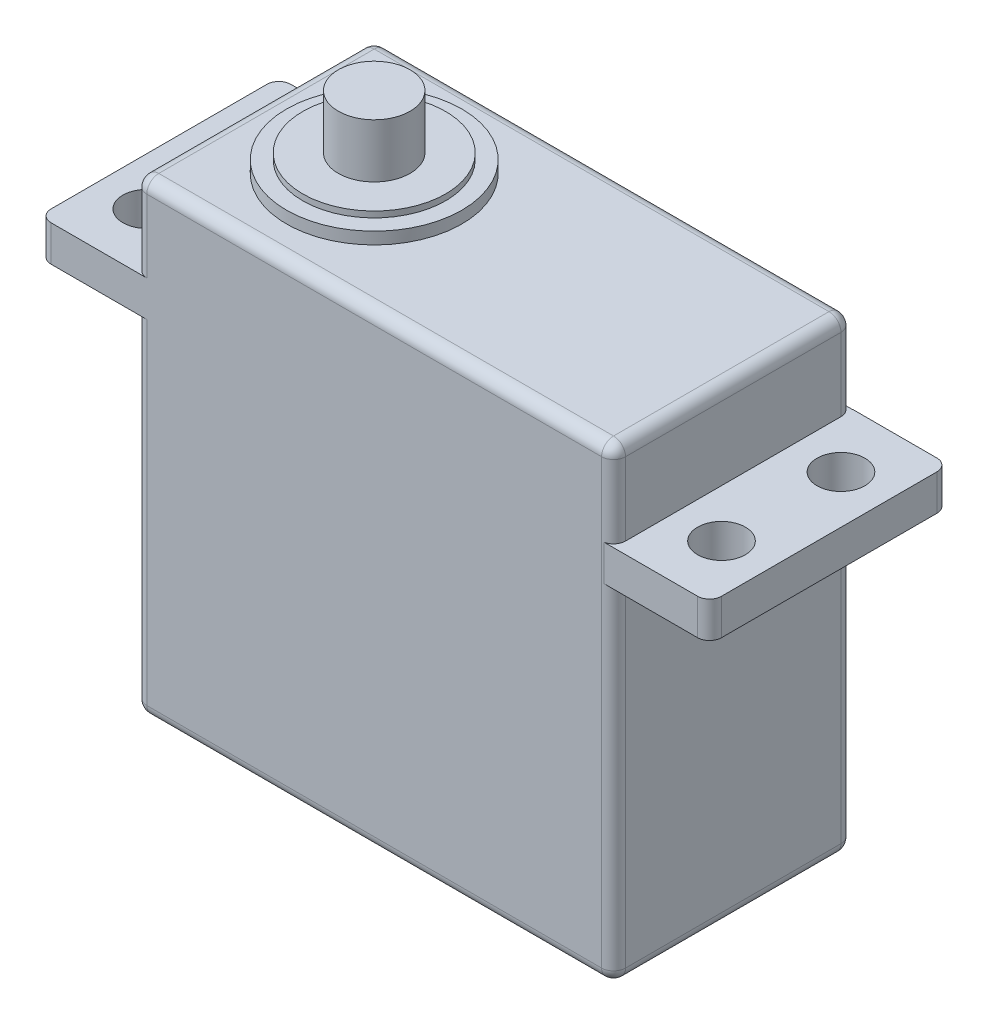
from build123d import *

# Parameters (mm, degrees)
SKETCH_1_W               = 40
SKETCH_1_H               = 39
EXTRUDE_1_DEPTH          = 20
SKETCH_3_W               = 20
SKETCH_3_H               = 3
EXTRUDE_2_DEPTH          = 8
SKETCH_6_W               = 20.033379722
SKETCH_6_H               = 3
EXTRUDE_4_DEPTH          = 8
CUT_EXTRUDE_1_DEPTH      = 38
CUT_EXTRUDE_1_DEPTH_BACK = 50
SKETCH_7_R               = 2
SKETCH_8_R               = 2
CUT_EXTRUDE_2_DEPTH      = 50
SKETCH_9_R               = 3
EXTRUDE_7_DEPTH          = 6
SKETCH_11_R              = 5.970559472
EXTRUDE_8_DEPTH          = 1.5
SKETCH_12_R              = 7.325621725
EXTRUDE_9_DEPTH          = 1
FILLET_3_R               = 1
FILLET_4_R               = 1
FILLET_5_R               = 1
FILLET_8_R               = 1
FILLET_9_R               = 1


with BuildPart() as part:
    # 草图1 → 凸台-拉伸1 (new body)
    with BuildSketch(Plane.XY):
        with Locations((-3.101604278, 17.200534759)):
            Rectangle(SKETCH_1_W, SKETCH_1_H)
    extrude(amount=EXTRUDE_1_DEPTH)

    # 草图3 → 凸台-拉伸2 (add)
    with BuildSketch(Plane(origin=(16.898395722, 0, 0), x_dir=(0, 0, -1), z_dir=(1, 0, 0))):
        with Locations((-9.980536854, 28.09692648)):
            Rectangle(SKETCH_3_W, SKETCH_3_H)
    extrude(amount=EXTRUDE_2_DEPTH)

    # 草图6 → 凸台-拉伸4 (add)
    with BuildSketch(Plane.ZY.offset(23.101604278)):
        with Locations((9.983310139, 28.130306202)):
            Rectangle(SKETCH_6_W, SKETCH_6_H)
    extrude(amount=EXTRUDE_4_DEPTH)

    # 草图7 → 切除-拉伸1 (cut, two sides: drawn at the far end of the back side and taken through both)
    with BuildSketch(Plane(origin=(0, 0, 0), x_dir=(1, 0, 0), z_dir=(0, 1, 0)).offset(-CUT_EXTRUDE_1_DEPTH_BACK)):
        with Locations(Location((-27.101604278, -15, 0), (0, 0, 180))):
            Circle(SKETCH_7_R)
        with Locations(Location((-27.101604278, -4.966620278, 0), (0, 0, 180))):
            Circle(SKETCH_7_R)
    extrude(amount=CUT_EXTRUDE_1_DEPTH + CUT_EXTRUDE_1_DEPTH_BACK, mode=Mode.SUBTRACT)

    # 草图8 → 切除-拉伸2 (cut)
    with BuildSketch(Plane(origin=(0, 29.59692648, 0), x_dir=(1, 0, 0), z_dir=(0, 1, 0))):
        with Locations(Location((20.898395722, -5, 0), (0, 0, 180))):
            Circle(SKETCH_8_R)
        with Locations(Location((20.898395722, -14.980536854, 0), (0, 0, 180))):
            Circle(SKETCH_8_R)
    extrude(amount=-CUT_EXTRUDE_2_DEPTH, mode=Mode.SUBTRACT)

    # 草图9 → 凸台-拉伸7 (add)
    with BuildSketch(Plane(origin=(0, 36.700534759, 0), x_dir=(1, 0, 0), z_dir=(0, 1, 0))):
        with Locations(Location((-13.101604278, -10, 0), (0, 0, 90))):
            Circle(SKETCH_9_R)
    extrude(amount=EXTRUDE_7_DEPTH)

    # 草图11 → 凸台-拉伸8 (add)
    with BuildSketch(Plane(origin=(0, 36.700534759, 0), x_dir=(1, 0, 0), z_dir=(0, 1, 0))):
        with Locations(Location((-13.101604278, -10, 0), (0, 0, 90))):
            Circle(SKETCH_11_R)
    extrude(amount=EXTRUDE_8_DEPTH)

    # 草图12 → 凸台-拉伸9 (add)
    with BuildSketch(Plane(origin=(0, 36.700534759, 0), x_dir=(1, 0, 0), z_dir=(0, 1, 0))):
        with Locations(Location((-13.101604278, -10, 0), (0, 0, 90))):
            Circle(SKETCH_12_R)
    extrude(amount=EXTRUDE_9_DEPTH)

    # 圆角3
    # the kernel refuses this fillet: 1 mm, written as the material it takes off along each edge
    with BuildSketch(Plane(origin=(15.898395722, 35.700534759, 19), x_dir=(0, 0, 1), z_dir=(0, 1, 0))) as fillet_3_piece_1_section:
        Polygon((0, 0), (FILLET_3_R, 0), (FILLET_3_R, FILLET_3_R), (0, FILLET_3_R), align=None)
    fillet_3_piece_1 = extrude(amount=FILLET_3_R, mode=Mode.PRIVATE)
    fillet_3_piece_1 = fillet_3_piece_1 - Plane(origin=(15.898395722, 35.700534759, 19), x_dir=(-0.7071067811865475, 0, -0.7071067811865475), z_dir=(0, 1, 0)) * Sphere(FILLET_3_R, mode=Mode.PRIVATE)
    add(fillet_3_piece_1, mode=Mode.SUBTRACT)
    with BuildSketch(Plane(origin=(16.898395722, 36.700534759, -2.5), x_dir=(-1, 0, 0), z_dir=(0, 0, 1))) as fillet_3_piece_2:
        with BuildLine():
            CenterArc((FILLET_3_R, FILLET_3_R), FILLET_3_R, 180, 90)
            Line((0, FILLET_3_R), (0, 0))
            Line((0, 0), (FILLET_3_R, 0))
        make_face()
    extrude(amount=21.5, mode=Mode.SUBTRACT)
    with BuildSketch(Plane(origin=(16.898395722, 35.700534759, 20), x_dir=(-1, 0, 0), z_dir=(0, -1, 0))) as fillet_3_piece_3_section:
        with BuildLine():
            CenterArc((FILLET_3_R, FILLET_3_R), FILLET_3_R, 180, 90)
            Line((0, FILLET_3_R), (0, 0))
            Line((0, 0), (FILLET_3_R, 0))
        make_face()
    fillet_3_piece_3 = extrude(amount=40.5, mode=Mode.PRIVATE)
    fillet_3_piece_3 = split(fillet_3_piece_3, bisect_by=Plane(origin=(16.437934638, 29.59692648, 20.00107683), z_dir=(0, 1, 0)), keep=Keep.TOP, mode=Mode.PRIVATE)
    fillet_3_piece_3 = split(fillet_3_piece_3, bisect_by=Plane(origin=(16.437934638, 32.648730619, 19.980536854), z_dir=(0, 0, 1)), keep=Keep.TOP, mode=Mode.PRIVATE)
    add(fillet_3_piece_3, mode=Mode.SUBTRACT)
    with BuildSketch(Plane(origin=(16.898395722, 35.700534759, 20), x_dir=(-1, 0, 0), z_dir=(0, -1, 0))) as fillet_3_piece_4_section:
        with BuildLine():
            CenterArc((FILLET_3_R, FILLET_3_R), FILLET_3_R, 180, 90)
            Line((0, FILLET_3_R), (0, 0))
            Line((0, 0), (FILLET_3_R, 0))
        make_face()
    fillet_3_piece_4 = extrude(amount=40.5, mode=Mode.PRIVATE)
    fillet_3_piece_4 = split(fillet_3_piece_4, bisect_by=Plane(origin=(16.712608884, 29.59692648, 19.734140611), z_dir=(0, 1, 0)), keep=Keep.TOP, mode=Mode.PRIVATE)
    fillet_3_piece_4 = split(fillet_3_piece_4, bisect_by=Plane(origin=(16.712608884, 32.648730619, 19.980536854), z_dir=(0, 0, -1)), keep=Keep.TOP, mode=Mode.PRIVATE)
    add(fillet_3_piece_4, mode=Mode.SUBTRACT)
    with BuildSketch(Plane(origin=(16.898395722, 35.700534759, 20), x_dir=(-1, 0, 0), z_dir=(0, -1, 0))) as fillet_3_piece_5_section:
        with BuildLine():
            CenterArc((FILLET_3_R, FILLET_3_R), FILLET_3_R, 180, 90)
            Line((0, FILLET_3_R), (0, 0))
            Line((0, 0), (FILLET_3_R, 0))
        make_face()
    fillet_3_piece_5 = extrude(amount=40.5, mode=Mode.PRIVATE)
    fillet_3_piece_5 = split(fillet_3_piece_5, bisect_by=Plane(origin=(16.437934638, 29.59692648, 20.00107683), z_dir=(0, -1, 0)), keep=Keep.TOP, mode=Mode.PRIVATE)
    fillet_3_piece_5 = split(fillet_3_piece_5, bisect_by=Plane(origin=(16.437934638, 28.09692648, 19.980536854), z_dir=(0, 0, 1)), keep=Keep.TOP, mode=Mode.PRIVATE)
    fillet_3_piece_5 = split(fillet_3_piece_5, bisect_by=Plane(origin=(16.437934638, 26.59692648, 20.00107683), z_dir=(0, 1, 0)), keep=Keep.TOP, mode=Mode.PRIVATE)
    add(fillet_3_piece_5, mode=Mode.SUBTRACT)
    with BuildSketch(Plane(origin=(16.898395722, 35.700534759, 20), x_dir=(-1, 0, 0), z_dir=(0, -1, 0))) as fillet_3_piece_6_section:
        with BuildLine():
            CenterArc((FILLET_3_R, FILLET_3_R), FILLET_3_R, 180, 90)
            Line((0, FILLET_3_R), (0, 0))
            Line((0, 0), (FILLET_3_R, 0))
        make_face()
    fillet_3_piece_6 = extrude(amount=40.5, mode=Mode.PRIVATE)
    fillet_3_piece_6 = split(fillet_3_piece_6, bisect_by=Plane(origin=(16.437934638, 10.898730619, 19.980536854), z_dir=(0, 0, 1)), keep=Keep.TOP, mode=Mode.PRIVATE)
    fillet_3_piece_6 = split(fillet_3_piece_6, bisect_by=Plane(origin=(16.437934638, 26.59692648, 20.00107683), z_dir=(0, -1, 0)), keep=Keep.TOP, mode=Mode.PRIVATE)
    add(fillet_3_piece_6, mode=Mode.SUBTRACT)
    with BuildSketch(Plane(origin=(16.898395722, 35.700534759, 20), x_dir=(-1, 0, 0), z_dir=(0, -1, 0))) as fillet_3_piece_7_section:
        with BuildLine():
            CenterArc((FILLET_3_R, FILLET_3_R), FILLET_3_R, 180, 90)
            Line((0, FILLET_3_R), (0, 0))
            Line((0, 0), (FILLET_3_R, 0))
        make_face()
    fillet_3_piece_7 = extrude(amount=40.5, mode=Mode.PRIVATE)
    fillet_3_piece_7 = split(fillet_3_piece_7, bisect_by=Plane(origin=(16.712608884, 10.898730619, 19.980536854), z_dir=(0, 0, -1)), keep=Keep.TOP, mode=Mode.PRIVATE)
    fillet_3_piece_7 = split(fillet_3_piece_7, bisect_by=Plane(origin=(16.712608884, 26.59692648, 19.734140611), z_dir=(0, -1, 0)), keep=Keep.TOP, mode=Mode.PRIVATE)
    add(fillet_3_piece_7, mode=Mode.SUBTRACT)
    with BuildSketch(Plane(origin=(-25.601604278, 36.700534759, 20), x_dir=(0, 0, -1), z_dir=(1, 0, 0))) as fillet_3_piece_8:
        with BuildLine():
            CenterArc((FILLET_3_R, -FILLET_3_R), FILLET_3_R, 90, 90)
            Line((0, -FILLET_3_R), (0, 0))
            Line((0, 0), (FILLET_3_R, 0))
        make_face()
    extrude(amount=41.5, mode=Mode.SUBTRACT)

    # 圆角4
    fillet_4_edges = [part.edges().sort_by_distance(p)[0] for p in [
        (-23.101604278, 12.16542048, 0),
        (-23.101604278, 12.16542048, 20),
        (-3.101604278, -2.299465241, 0),
        (-23.101604278, -2.299465241, 10),
        (-3.601604278, -2.299465241, 20),
        (16.898395722, -2.299465241, 9.5),
        (16.605502503, -2.299465241, 19.707106781),
    ]]
    fillet(fillet_4_edges, radius=FILLET_4_R)

    # 圆角5
    # the kernel refuses this fillet: 1 mm, written as the material it takes off along each edge
    with BuildSketch(Plane(origin=(15.898395722, -1.299465241, 1), x_dir=(1, 0, 0), z_dir=(0, 0, -1))) as fillet_5_piece_1_section:
        Polygon((0, 0), (FILLET_5_R * 1.02, 0), (FILLET_5_R * 1.02, FILLET_5_R * 1.02), (0, FILLET_5_R * 1.02), align=None)
    fillet_5_piece_1 = extrude(amount=FILLET_5_R * 1.02, mode=Mode.PRIVATE)
    fillet_5_piece_1 = fillet_5_piece_1 - Plane(origin=(15.898395722, -1.299465241, 1), x_dir=(-0.7071067811865476, 0.7071067811865475, 0), z_dir=(0, 0, -1)) * Sphere(FILLET_5_R, mode=Mode.PRIVATE)
    add(fillet_5_piece_1, mode=Mode.SUBTRACT)
    with BuildSketch(Plane(origin=(-22.101604278, 35.700534759, 1), x_dir=(-1, 0, 0), z_dir=(0, 0, -1))) as fillet_5_piece_2_section:
        Polygon((0, 0), (FILLET_5_R * 1.02, 0), (FILLET_5_R * 1.02, FILLET_5_R * 1.02), (0, FILLET_5_R * 1.02), align=None)
    fillet_5_piece_2 = extrude(amount=FILLET_5_R * 1.02, mode=Mode.PRIVATE)
    fillet_5_piece_2 = fillet_5_piece_2 - Plane(origin=(-22.101604278, 35.700534759, 1), x_dir=(0.7071067811865476, -0.7071067811865475, 0), z_dir=(0, 0, -1)) * Sphere(FILLET_5_R, mode=Mode.PRIVATE)
    add(fillet_5_piece_2, mode=Mode.SUBTRACT)
    with BuildSketch(Plane(origin=(16.898395722, 26.59692648, 0), x_dir=(-1, 0, 0), z_dir=(0, -1, 0))) as fillet_5_piece_3:
        with BuildLine():
            CenterArc((FILLET_5_R, -FILLET_5_R), FILLET_5_R, 90, 90)
            Line((0, -FILLET_5_R), (0, 0))
            Line((0, 0), (FILLET_5_R, 0))
        make_face()
    extrude(amount=27.89639172, mode=Mode.SUBTRACT)
    with BuildSketch(Plane(origin=(16.898395722, 35.700534759, 0), x_dir=(-1, 0, 0), z_dir=(0, -1, 0))) as fillet_5_piece_4:
        with BuildLine():
            CenterArc((FILLET_5_R, -FILLET_5_R), FILLET_5_R, 90, 90)
            Line((0, -FILLET_5_R), (0, 0))
            Line((0, 0), (FILLET_5_R, 0))
        make_face()
    extrude(amount=6.10360828, mode=Mode.SUBTRACT)
    with BuildSketch(Plane(origin=(-23.101604278, 29.630306202, 0), x_dir=(1, 0, 0), z_dir=(0, 1, 0)), Plane(origin=(-23.101604278, 29.630306202, 20), x_dir=(0, 0, -1), z_dir=(0, 1, 0))) as fillet_5_piece_5:
        with BuildLine():
            CenterArc((FILLET_5_R, -FILLET_5_R), FILLET_5_R, 90, 90)
            Line((0, -FILLET_5_R), (0, 0))
            Line((0, 0), (FILLET_5_R, 0))
        make_face()
    extrude(amount=6.070228558, mode=Mode.SUBTRACT)
    with BuildSketch(Plane(origin=(-22.101604278, 36.700534759, 0), x_dir=(0, -1, 0), z_dir=(1, 0, 0))) as fillet_5_piece_6:
        with BuildLine():
            CenterArc((FILLET_5_R, -FILLET_5_R), FILLET_5_R, 90, 90)
            Line((0, -FILLET_5_R), (0, 0))
            Line((0, 0), (FILLET_5_R, 0))
        make_face()
    extrude(amount=38, mode=Mode.SUBTRACT)
    with BuildSketch(Plane(origin=(-23.101604278, 36.700534759, 1), x_dir=(0, -1, 0), z_dir=(0, 0, 1))) as fillet_5_piece_7:
        with BuildLine():
            CenterArc((FILLET_5_R, FILLET_5_R), FILLET_5_R, 180, 90)
            Line((0, FILLET_5_R), (0, 0))
            Line((0, 0), (FILLET_5_R, 0))
        make_face()
    extrude(amount=18, mode=Mode.SUBTRACT)
    with BuildSketch(Plane(origin=(15.898395722, 35.700534759, 0), x_dir=(0, 1, 0), z_dir=(-1, 0, 0))) as fillet_5_piece_8:
        with BuildLine():
            CenterArc((1 - FILLET_5_R, -FILLET_5_R), FILLET_5_R, 0, 90)
            Line((1, -FILLET_5_R), (1, 0))
            Line((1, 0), (1 - FILLET_5_R, 0))
        make_face()
    revolve(axis=Axis((15.898395722, 35.700534759, 0), (0, 0, -1)), revolution_arc=90, mode=Mode.SUBTRACT)
    with BuildSketch(Plane(origin=(-23.101604278, 35.700534759, 19), x_dir=(0, 0, 1), z_dir=(0, -1, 0))) as fillet_5_piece_9:
        with BuildLine():
            CenterArc((1 - FILLET_5_R, -FILLET_5_R), FILLET_5_R, 0, 90)
            Line((1, -FILLET_5_R), (1, 0))
            Line((1, 0), (1 - FILLET_5_R, 0))
        make_face()
    revolve(axis=Axis((-23.101604278, 35.700534759, 19), (-1, 0, 0)), revolution_arc=90, mode=Mode.SUBTRACT)

    # 圆角8
    fillet_8_edges = [part.edges().sort_by_distance(p)[0] for p in [
        (24.898395722, 28.09692648, -0.019463146),
        (24.898395722, 28.09692648, 19.980536854),
    ]]
    fillet(fillet_8_edges, radius=FILLET_8_R)

    # 圆角9
    fillet_9_edges = [part.edges().sort_by_distance(p)[0] for p in [
        (-31.101604278, 28.130306202, 20),
        (-31.101604278, 28.130306202, -0.033379722),
    ]]
    fillet(fillet_9_edges, radius=FILLET_9_R)


solid = part.part
